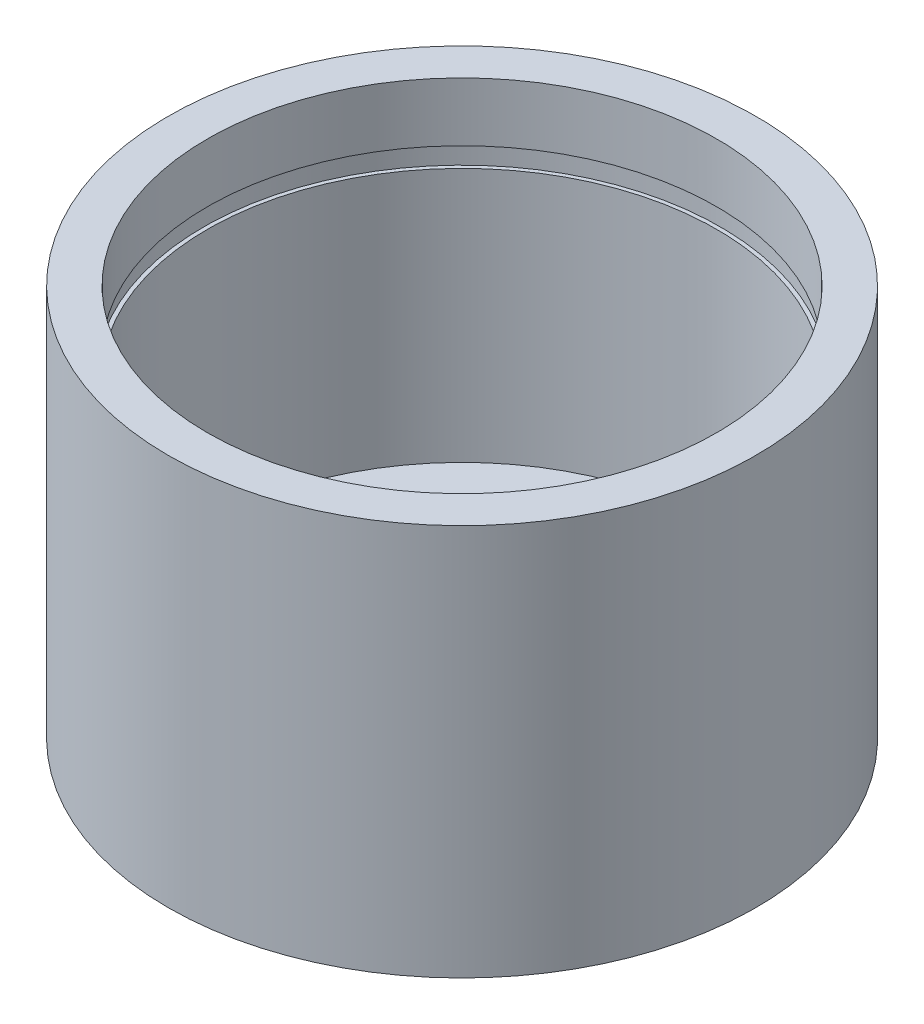
from build123d import *

# Parameters (mm, degrees)
SKETCH1_R           = 7.5
BOSS_EXTRUDE1_DEPTH = 10
SKETCH2_R           = 6.5
CUT_EXTRUDE1_DEPTH  = 8.5
CAVITY1_START       = 8
CAVITY1_OUTLINE_R   = 6.6
CAVITY1_DEPTH       = 0.5


# Read off the part's stored shape, not the designer's step: Cavity1
with BuildPart() as part:
    # Sketch1 → Boss-Extrude1 (new body)
    with BuildSketch(Plane(origin=(0, 0, 0), x_dir=(1, 0, 0), z_dir=(0, 1, 0))):
        with Locations(Location((0, 0, 0), (0, 0, 270))):
            Circle(SKETCH1_R)
    extrude(amount=BOSS_EXTRUDE1_DEPTH)

    # Sketch2 → Cut-Extrude1 (cut)
    with BuildSketch(Plane(origin=(0, 10, 0), x_dir=(1, 0, 0), z_dir=(0, 1, 0))):
        with Locations(Location((0, 0, 0), (0, 0, 270))):
            Circle(SKETCH2_R)
    extrude(amount=-CUT_EXTRUDE1_DEPTH, mode=Mode.SUBTRACT)

    # Cavity1 outline → Cavity1 (cut)
    with BuildSketch(Plane(origin=(0, 0, 0), x_dir=(1, 0, 0), z_dir=(0, 1, 0)).offset(CAVITY1_START)):
        Circle(CAVITY1_OUTLINE_R)
    extrude(amount=CAVITY1_DEPTH, mode=Mode.SUBTRACT)


solid = part.part
